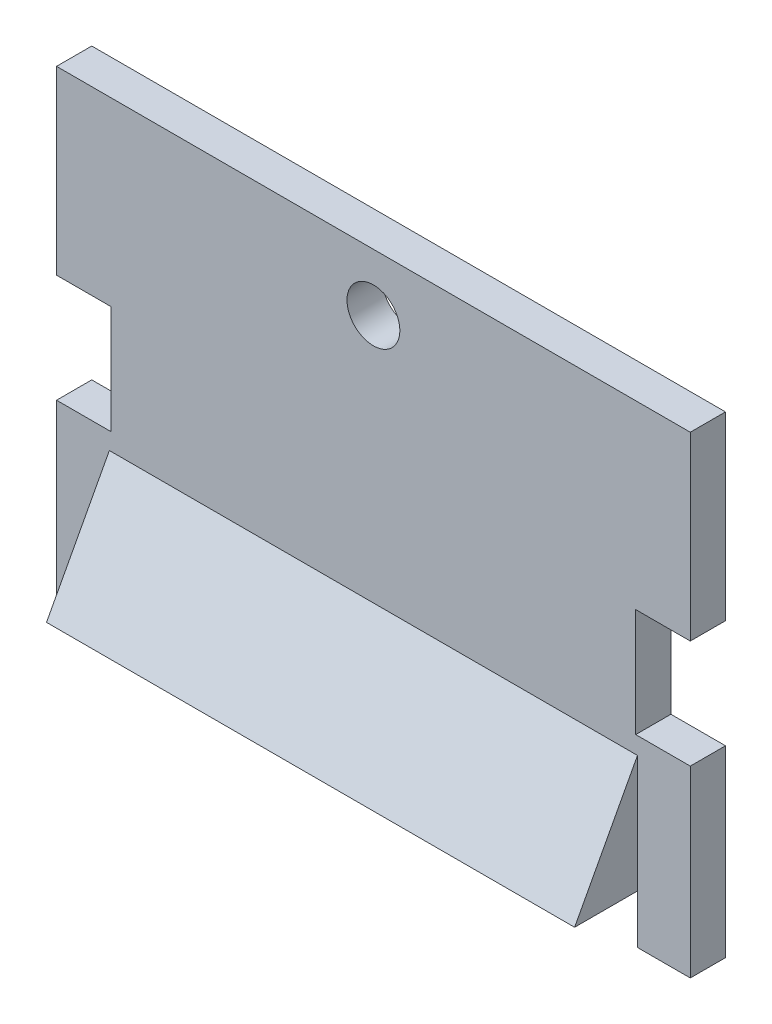
from build123d import *

# Parameters (mm, degrees)
BOSS_EXTRUDE1_DEPTH = 18
SKETCH2_R           = 1.5
SKETCH2_W           = 30
SKETCH2_H           = 2.78
CUT_EXTRUDE1_DEPTH  = 33.801637154
SKETCH3_W           = 3.1
SKETCH3_H           = 6.15
CUT_EXTRUDE2_DEPTH  = 33.801637154
SKETCH4_W           = 3
SKETCH4_H           = 7.645
CUT_EXTRUDE3_DEPTH  = 33.521798843


with BuildPart() as part:
    # Sketch1 → Boss-Extrude1 (new, symmetric)
    with BuildSketch(Plane(origin=(0, 0, 0), x_dir=(0, 0, -1), z_dir=(1, 0, 0))):
        Polygon((0, 0), (0, 26.85), (-2, 26.85), (-2, 9.45), (-5.57, 2.78), (-2, 2.78), (-2, 0), align=None)
    extrude(amount=BOSS_EXTRUDE1_DEPTH, both=True)

    # Sketch2 → Cut-Extrude1 (cut, through all)
    with BuildSketch(Plane(origin=(0, 0, 0), x_dir=(-1, 0, 0), z_dir=(0, 0, -1))):
        with Locations((0, 23.6)):
            Circle(SKETCH2_R)
        with Locations((0, 1.39)):
            Rectangle(SKETCH2_W, SKETCH2_H)
    extrude(amount=-CUT_EXTRUDE1_DEPTH, mode=Mode.SUBTRACT)

    # Sketch3 → Cut-Extrude2 (cut, through all)
    with BuildSketch(Plane(origin=(0, 0, 0), x_dir=(-1, 0, 0), z_dir=(0, 0, -1))):
        with Locations((-16.45, 13.5)):
            Rectangle(SKETCH3_W, SKETCH3_H)
        with Locations((16.45, 13.5)):
            Rectangle(SKETCH3_W, SKETCH3_H)
    extrude(amount=-CUT_EXTRUDE2_DEPTH, mode=Mode.SUBTRACT)

    # Sketch4 → Cut-Extrude3 (cut, through all)
    with BuildSketch(Plane.XY.offset(2)):
        with Locations((-16.5, 6.6025)):
            Rectangle(SKETCH4_W, SKETCH4_H)
        with Locations((16.5, 6.6025)):
            Rectangle(SKETCH4_W, SKETCH4_H)
    extrude(amount=CUT_EXTRUDE3_DEPTH, mode=Mode.SUBTRACT)


solid = part.part
